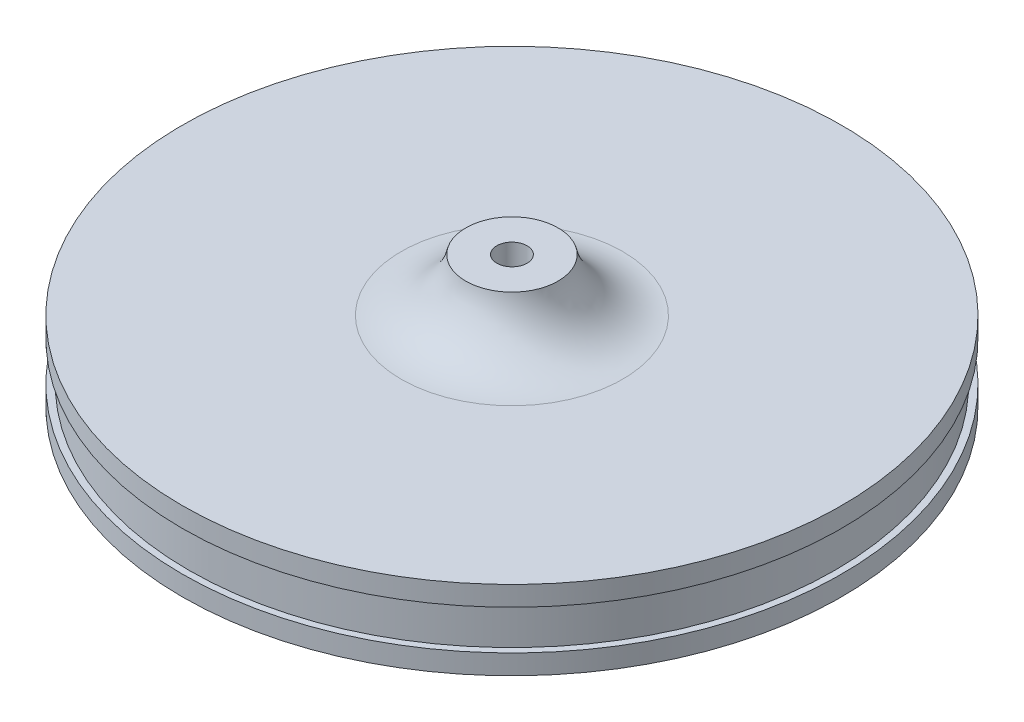
from build123d import *

# Parameters (mm, degrees)
SKETCH1_R           = 25
SKETCH1_R_2         = 1.15
BOSS_EXTRUDE1_DEPTH = 6
SKETCH1_3_R         = 3.5
SKETCH1_3_R_2       = 1.15
BOSS_EXTRUDE2_DEPTH = 10
FILLET1_R           = 5
SKETCH2_W           = 0.5
SKETCH2_H           = 3


with BuildPart() as part:
    # Sketch1 → Boss-Extrude1 (new body)
    with BuildSketch(Plane(origin=(0, 0, 0), x_dir=(1, 0, 0), z_dir=(0, 1, 0))):
        with Locations(Location((0, 0, 0), (0, 0, 270))):
            Circle(SKETCH1_R)
        with Locations(Location((0, 0, 0), (0, 0, 270))):
            Circle(SKETCH1_R_2, mode=Mode.SUBTRACT)
    extrude(amount=BOSS_EXTRUDE1_DEPTH)

    # Sketch1<3> → Boss-Extrude2 (add)
    with BuildSketch(Plane(origin=(0, 0, 0), x_dir=(1, 0, 0), z_dir=(0, 1, 0))):
        with Locations(Location((0, 0, 0), (0, 0, 270))):
            Circle(SKETCH1_3_R)
        with Locations(Location((0, 0, 0), (0, 0, 270))):
            Circle(SKETCH1_3_R_2, mode=Mode.SUBTRACT)
    extrude(amount=BOSS_EXTRUDE2_DEPTH)

    # Fillet1
    # the kernel refuses this fillet: 5 mm, written as the material it adds along each edge
    with BuildSketch(Plane(origin=(0, 6, 0), x_dir=(0, 0, 1), z_dir=(1, 0, 0))) as fillet1_piece_1:
        with BuildLine():
            CenterArc((8.398979486, -5), FILLET1_R, 90, 78.463040967)
            Line((3.5, -4), (3.40202041, -3.98))
            ThreePointArc((3.40202041, -3.98), (3.4, -2), (3.4, 0))
            Line((3.4, 0), (3.5, 0.1))
            Line((3.5, 0.1), (8.398979486, 0.1))
            Line((8.398979486, 0.1), (8.398979486, 0))
        make_face()
    revolve(axis=Axis((0, 6, 0), (0, -1, 0)))

    # Sketch2 → Cut-Revolve1 (revolve, cut)
    with BuildSketch(Plane.XY, mode=Mode.PRIVATE) as cut_revolve1_sk:
        with Locations((24.75, 3)):
            Rectangle(SKETCH2_W, SKETCH2_H)
    revolve(cut_revolve1_sk.sketch.rotate(Axis((0, 6, 0), (0, -1, 0)), 90), axis=Axis((0, 6, 0), (0, -1, 0)), mode=Mode.SUBTRACT)


solid = part.part
